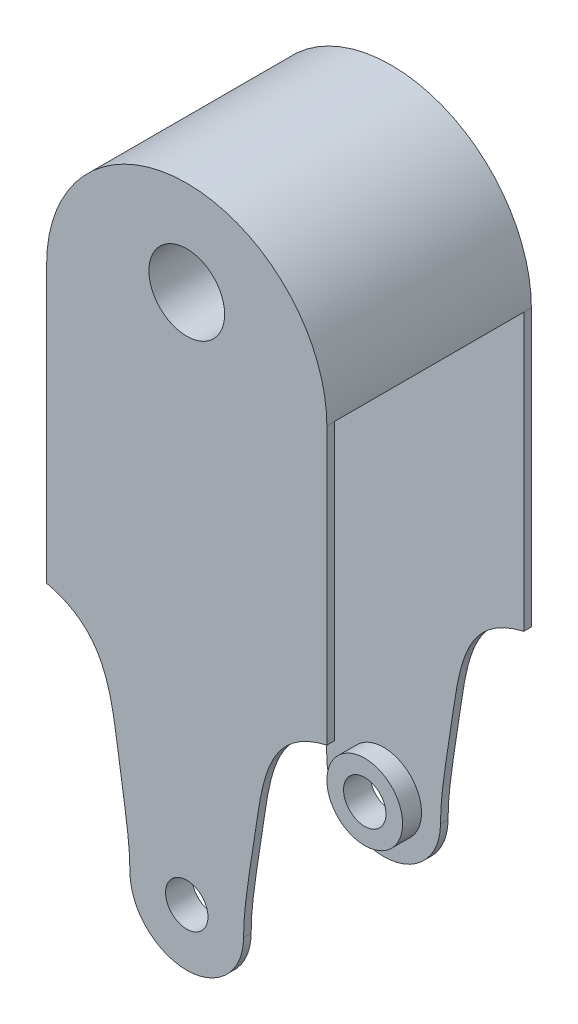
from build123d import *
from build123d.topology import SkipClean

# Parameters (mm, degrees)
CROQUIS1_R              = 10
SALIENTE_EXTRUIR1_DEPTH = 54
CROQUIS6_W              = 54
CROQUIS6_H              = 70
SALIENTE_EXTRUIR3_DEPTH = 74
CORTAR_EXTRUIR13_DEPTH  = 74
CORTAR_EXTRUIR14_DEPTH  = 74
CROQUIS9_W              = 3
CROQUIS9_H              = 11.2
CORTAR_EXTRUIR15_DEPTH  = 74
CROQUIS10_R             = 5.6
CORTAR_EXTRUIR16_DEPTH  = 74
SALIENTE_EXTRUIR4_START = 5
CROQUIS11_R             = 10
CROQUIS11_R_2           = 5.6
SALIENTE_EXTRUIR4_DEPTH = 5
CROQUIS12_R             = 10
CROQUIS12_R_2           = 5.6
SALIENTE_EXTRUIR5_DEPTH = 5
CROQUIS13_W             = 50
CROQUIS13_H             = 73
CORTAR_EXTRUIR17_DEPTH  = 74


with BuildPart() as part:
    # Croquis1 → Saliente-Extruir1 (new body)
    with BuildSketch(Plane.XY):
        with BuildLine():
            ThreePointArc((74, 143), (37, 180), (0, 143))
            Line((0, 143), (0, 70))
            add(Edge.make_bspline(
                [(22, 15), (22, 22.317960933), (17.777719643, 44.524463784), (15.903513438, 66.300635574), (0, 70)],
                knots=[0, 0, 0, 0, 0.399675276, 1, 1, 1, 1], degree=3))
            ThreePointArc((22, 15), (26.393398282, 4.393398282), (37, 0))
            ThreePointArc((37, 0), (47.606601718, 4.393398282), (52, 15))
            add(Edge.make_bspline(
                [(52, 15), (52, 22.317960933), (56.222280357, 44.524463784), (58.096486562, 66.300635574), (74, 70)],
                knots=[0, 0, 0, 0, 0.399675276, 1, 1, 1, 1], degree=3))
            Line((74, 70), (74, 143))
        make_face()
        with BuildLine():
            ThreePointArc((42.6, 15), (40.959797975, 11.040202025), (37, 9.4))
            ThreePointArc((37, 9.4), (33.040202025, 18.959797975), (42.6, 15))
        make_face(mode=Mode.SUBTRACT)
        with Locations((37, 155)):
            Circle(CROQUIS1_R, mode=Mode.SUBTRACT)
    extrude(amount=SALIENTE_EXTRUIR1_DEPTH)

    # Croquis6 → Saliente-Extruir3 (add)
    with BuildSketch(Plane.ZY):
        with Locations((27, 35)):
            Rectangle(CROQUIS6_W, CROQUIS6_H)
    extrude(amount=-SALIENTE_EXTRUIR3_DEPTH)

    # Croquis7 → Cortar-Extruir13 (cut)
    with BuildSketch(Plane(origin=(74, 0, 0), x_dir=(0, 0, -1), z_dir=(1, 0, 0))):
        Polygon((-52, 0), (-2, 0), (-2, 9.4), (-5, 9.4), (-5, 20.6), (-2, 20.6), (-2, 70), (-52, 70), (-52, 20.6), (-49, 20.6), (-49, 9.4), (-52, 9.4), align=None)
    extrude(amount=-CORTAR_EXTRUIR13_DEPTH, mode=Mode.SUBTRACT)

    # Croquis8 → Cortar-Extruir14 (cut)
    with BuildSketch(Plane(origin=(0, 0, 0), x_dir=(-1, 0, 0), z_dir=(0, 0, -1))):
        with BuildLine():
            add(Edge.make_bspline(
                [(-74, 70), (-58.096486562, 66.300635574), (-56.222280357, 44.524463784), (-52, 22.317960933), (-52, 15)],
                knots=[0, 0, 0, 0, 0.600324724, 1, 1, 1, 1], degree=3))
            Line((-74, 70), (-74, 0))
            Line((-74, 0), (-37, 0))
            ThreePointArc((-37, 0), (-47.606601718, 4.393398282), (-52, 15))
        make_face()
        with BuildLine():
            ThreePointArc((-22, 15), (-26.393398282, 4.393398282), (-37, 0))
            Line((-37, 0), (0, 0))
            Line((0, 0), (0, 70))
            add(Edge.make_bspline(
                [(-22, 15), (-22, 22.317960933), (-17.777719643, 44.524463784), (-15.903513438, 66.300635574), (0, 70)],
                knots=[0, 0, 0, 0, 0.399675276, 1, 1, 1, 1], degree=3))
        make_face()
    extrude(amount=-CORTAR_EXTRUIR14_DEPTH, mode=Mode.SUBTRACT)

    # Croquis9 → Cortar-Extruir15 (cut)
    with BuildSketch(Plane(origin=(74, 0, 0), x_dir=(0, 0, -1), z_dir=(1, 0, 0))):
        with Locations((-50.5, 15)):
            Rectangle(CROQUIS9_W, CROQUIS9_H)
        Polygon((-2, 20.6), (-5.198845147, 20.6), (-5, 9.4), (-2, 9.4), align=None)
    extrude(amount=-CORTAR_EXTRUIR15_DEPTH, mode=Mode.SUBTRACT)

    # Croquis10 → Cortar-Extruir16 (cut)
    with BuildSketch(Plane(origin=(0, 0, 0), x_dir=(-1, 0, 0), z_dir=(0, 0, -1))):
        with Locations((-37, 15)):
            Circle(CROQUIS10_R)
    extrude(amount=-CORTAR_EXTRUIR16_DEPTH, mode=Mode.SUBTRACT)

    # Croquis11 → Saliente-Extruir4 (add)
    with BuildSketch(Plane(origin=(0, 0, 52), x_dir=(-1, 0, 0), z_dir=(0, 0, -1)).offset(SALIENTE_EXTRUIR4_START)):
        with Locations((-37, 15)):
            Circle(CROQUIS11_R)
        with Locations((-37, 15)):
            Circle(CROQUIS11_R_2, mode=Mode.SUBTRACT)
    extrude(amount=-SALIENTE_EXTRUIR4_DEPTH)

    # Croquis12 → Saliente-Extruir5 (add)
    with SkipClean():  # the faces are left unmerged after this step: merging them gives an invalid solid
        with BuildSketch(Plane.XY.offset(2)):
            with Locations((37, 15)):
                Circle(CROQUIS12_R)
            with Locations((37, 15)):
                Circle(CROQUIS12_R_2, mode=Mode.SUBTRACT)
        extrude(amount=SALIENTE_EXTRUIR5_DEPTH)

    # Croquis13 → Cortar-Extruir17 (cut)
    with SkipClean():  # the faces are left unmerged after this step: merging them gives an invalid solid
        with BuildSketch(Plane.ZY):
            with Locations((27, 106.5)):
                Rectangle(CROQUIS13_W, CROQUIS13_H)
        extrude(amount=-CORTAR_EXTRUIR17_DEPTH, mode=Mode.SUBTRACT)


solid = part.part
